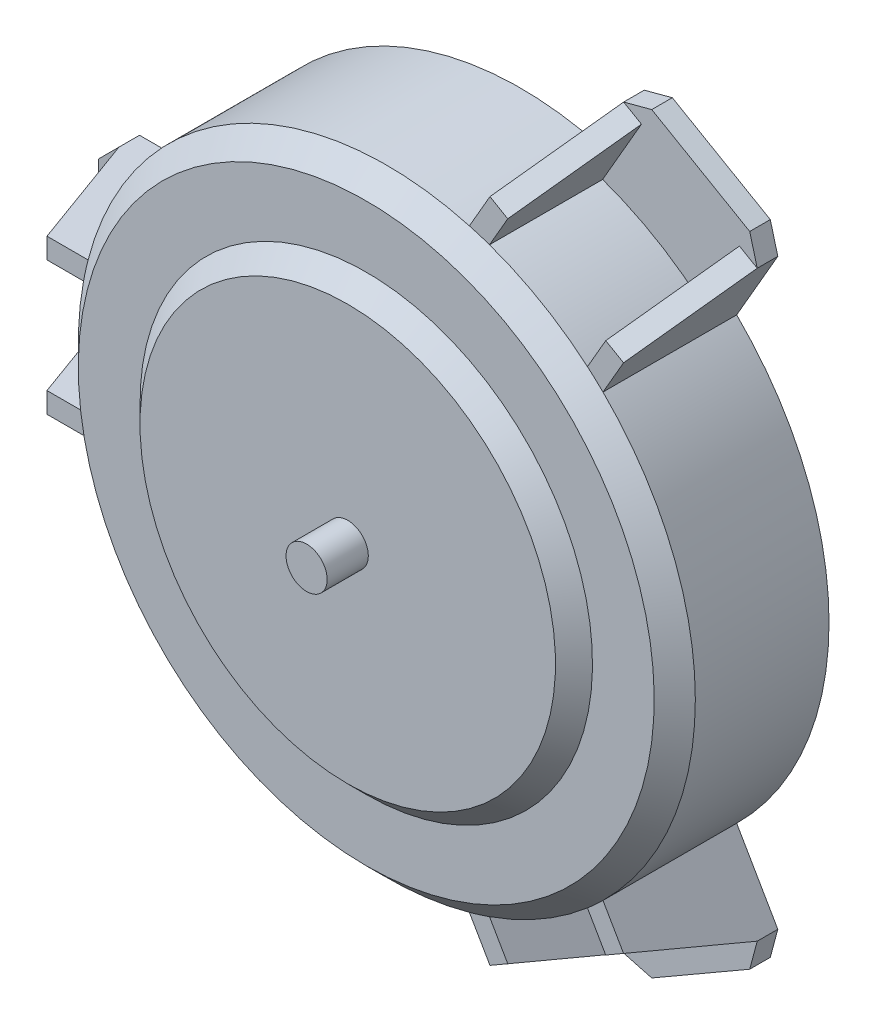
from build123d import *

# Parameters (mm, degrees)
SKETCH1_R                    = 150
BOSS_EXTRUDE1_DEPTH          = 75
CHAMFER1_SIZE                = 10
BOSS_EXTRUDE2_START          = -75
BOSS_EXTRUDE2_DEPTH          = 10
CHAMFER2_SIZE                = 10
BOSS_EXTRUDE3_DEPTH          = 10
CIRPATTERN2_COUNT            = 3
CIRPATTERN2_COPY_1_DEPTH     = 10
CIRPATTERN2_COPY_2_DEPTH     = 10
CHAMFER2_OF_CIRPATTERN2_SIZE = 10
SKETCH4_R                    = 110
BOSS_EXTRUDE4_DEPTH          = 9
BOSS_EXTRUDE4_TAPER          = 45
SKETCH5_R                    = 10
BOSS_EXTRUDE5_DEPTH          = 20
BODY_MOVE_COPY1_ANGLE        = 90


with BuildPart() as part:
    # Sketch1 → Boss-Extrude1 (new body)
    with BuildSketch(Plane(origin=(0, 0, 0), x_dir=(1, 0, 0), z_dir=(0, 1, 0))):
        with Locations(Location((0, 0, 0), (0, 0, 270))):
            Circle(SKETCH1_R)
    extrude(amount=BOSS_EXTRUDE1_DEPTH)

    # Chamfer1
    chamfer1_edges = [part.edges().sort_by_distance(p)[0] for p in [
        (0, 75, -150),
    ]]
    chamfer(chamfer1_edges, length=CHAMFER1_SIZE)

    # Sketch2 → Boss-Extrude2 (add)
    with BuildSketch(Plane(origin=(0, 75, 0), x_dir=(1, 0, 0), z_dir=(0, 1, 0)).offset(BOSS_EXTRUDE2_START)):
        with BuildLine():
            Line((-195.236875483, -37.5), (-195.236875483, 37.5))
            Line((-195.236875483, 37.5), (-145.236875483, 37.5))
            ThreePointArc((-145.236875483, 37.5), (-150, 0), (-145.236875483, -37.5))
            Line((-145.236875483, -37.5), (-195.236875483, -37.5))
        make_face()
    boss_extrude2 = extrude(amount=BOSS_EXTRUDE2_DEPTH)

    # Chamfer2
    chamfer2_edges = [part.edges().sort_by_distance(p)[0] for p in [
        (-195.236875483, 5, -37.5),
        (-195.236875483, 5, 37.5),
    ]]
    chamfer(chamfer2_edges, length=CHAMFER2_SIZE)

    # Sketch3 → Boss-Extrude3 (add)
    with BuildSketch(Plane.XY.offset(37.5)):
        Polygon((-145.236875483, 10), (-145.236875483, 65), (-165.236875483, 65), (-185.236875483, 10), align=None)
    boss_extrude3 = extrude(amount=-BOSS_EXTRUDE3_DEPTH)

    # Mirror3: Boss-Extrude3 across plane
    add(boss_extrude3.mirror(Plane.XY))

    # CirPattern2: Boss-Extrude2, Boss-Extrude3 ×3 about axis
    cirpattern2_axis = Axis((0, 0, 0), (0, 1, 0))
    add([boss_extrude2.rotate(cirpattern2_axis, i * 360 / CIRPATTERN2_COUNT) for i in range(1, CIRPATTERN2_COUNT)])
    add([boss_extrude3.rotate(cirpattern2_axis, i * 360 / CIRPATTERN2_COUNT) for i in range(1, CIRPATTERN2_COUNT)])

    # CirPattern2 copy 1 sketch → CirPattern2 copy 1 (add)
    with BuildSketch(Plane(origin=(-32.475952642, 0, 18.75), x_dir=(-0.4999999999999998, 0, -0.8660254037844387), z_dir=(-0.8660254037844387, 0, 0.4999999999999998))):
        Polygon((-145.236875483, -10), (-145.236875483, -65), (-165.236875483, -65), (-185.236875483, -10), align=None)
    extrude(amount=-CIRPATTERN2_COPY_1_DEPTH)

    # CirPattern2 copy 2 sketch → CirPattern2 copy 2 (add)
    with BuildSketch(Plane(origin=(32.475952642, 0, 18.75), x_dir=(-0.5000000000000004, 0, 0.8660254037844384), z_dir=(0.8660254037844384, 0, 0.5000000000000004))):
        Polygon((-145.236875483, -10), (-145.236875483, -65), (-165.236875483, -65), (-185.236875483, -10), align=None)
    extrude(amount=-CIRPATTERN2_COPY_2_DEPTH)

    # Chamfer2 of CirPattern2
    chamfer2_of_cirpattern2_edges = [part.edges().sort_by_distance(p)[0] for p in [
        (65.142485099, 5, 187.830093924),
        (130.094390383, 5, 150.330093924),
        (130.094390383, 5, -150.330093924),
        (65.142485099, 5, -187.830093924),
    ]]
    chamfer(chamfer2_of_cirpattern2_edges, length=CHAMFER2_OF_CIRPATTERN2_SIZE)

    # Sketch4 → Boss-Extrude4 (add)
    with BuildSketch(Plane(origin=(0, 75, 0), x_dir=(1, 0, 0), z_dir=(0, 1, 0))):
        Circle(SKETCH4_R)
    extrude(amount=BOSS_EXTRUDE4_DEPTH, taper=BOSS_EXTRUDE4_TAPER)

    # Sketch5 → Boss-Extrude5 (add)
    with BuildSketch(Plane(origin=(0, 84, 0), x_dir=(1, 0, 0), z_dir=(0, 1, 0))):
        with Locations(Location((0, 0, 0), (0, 0, 270))):
            Circle(SKETCH5_R)
    extrude(amount=BOSS_EXTRUDE5_DEPTH)


with BuildPart() as part_1:
    # Body-Move/Copy1: read off the stored shape, not the designer's step
    # Body-Move/Copy1: moved
    add(part.part.rotate(Axis((0, 0, 0), (1, 0, 0)), BODY_MOVE_COPY1_ANGLE))


with BuildPart() as part_2:
    # Body-Move/Copy2: moved
    add(part_1.part.moved(Location((5e-08, 0, -83.99999995))))


solid = part_2.part
